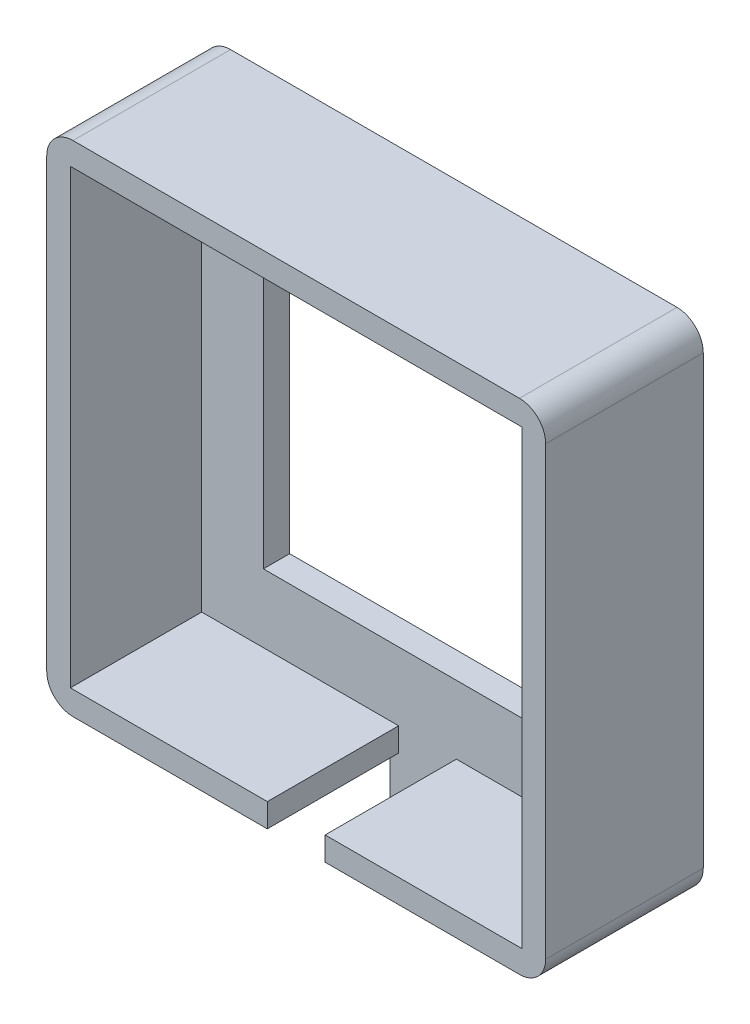
from build123d import *

# Parameters (mm, degrees)
ESQUISSE1_W        = 38
ESQUISSE1_H        = 38
ESQUISSE1_W_2      = 25
ESQUISSE1_H_2      = 25
BOSS_EXTRU_1_DEPTH = 2
BOSS_EXTRU_2_DEPTH = 10
CONG_1_R           = 2
ESQUISSE3_R        = 1
BOSS_EXTRU_3_DEPTH = 2


# Read off the part's stored shape, not the designer's step: Boss.-Extru.2
with BuildPart() as part:
    # Esquisse1 → Boss.-Extru.1 (new body)
    with BuildSketch(Plane.XY):
        with Locations((-5.018947996, 3.742614476)):
            Rectangle(ESQUISSE1_W, ESQUISSE1_H)
        with Locations((-5.018947996, 4.242614476)):
            Rectangle(ESQUISSE1_W_2, ESQUISSE1_H_2, mode=Mode.SUBTRACT)
    extrude(amount=BOSS_EXTRU_1_DEPTH)

    # Boss.-Extru.2 outline → Boss.-Extru.2 (add)
    with BuildSketch(Plane.XY.offset(2)):
        Polygon((-24.018947996, 22.742614476), (-24.018947996, -15.257385524), (-7.218947996, -15.257385524), (-7.218947996, -13.457385524), (-22.218947996, -13.457385524), (-22.218947996, 20.942614476), (12.181052004, 20.942614476), (12.181052004, -13.457385524), (-2.818947996, -13.457385524), (-2.818947996, -15.257385524), (13.981052004, -15.257385524), (13.981052004, 22.742614476), align=None)
    extrude(amount=BOSS_EXTRU_2_DEPTH)

    # Congé1
    cong_1_edges = [part.edges().sort_by_distance(p)[0] for p in [
        (-24.018947996, 22.742614476, 6),
        (13.981052004, 22.742614476, 7),
        (13.981052004, -15.257385524, 7),
        (-24.018947996, -15.257385524, 7),
    ]]
    fillet(cong_1_edges, radius=CONG_1_R)

    # Esquisse3 → Boss.-Extru.3 (add)
    with BuildSketch(Plane(origin=(0, 0, 0), x_dir=(-1, 0, 0), z_dir=(0, 0, -1))):
        with BuildLine():
            Line((2.142498892, -15.257385524), (2.142498892, -19.257385524))
            ThreePointArc((2.142498892, -19.257385524), (5.018947996, -22.133834629), (7.895397101, -19.257385524))
            Line((7.895397101, -19.257385524), (7.895397101, -15.257385524))
            Line((7.895397101, -15.257385524), (2.142498892, -15.257385524))
        make_face()
        with Locations((5.018947996, -19.257385524)):
            Circle(ESQUISSE3_R, mode=Mode.SUBTRACT)
    extrude(amount=-BOSS_EXTRU_3_DEPTH)


solid = part.part
